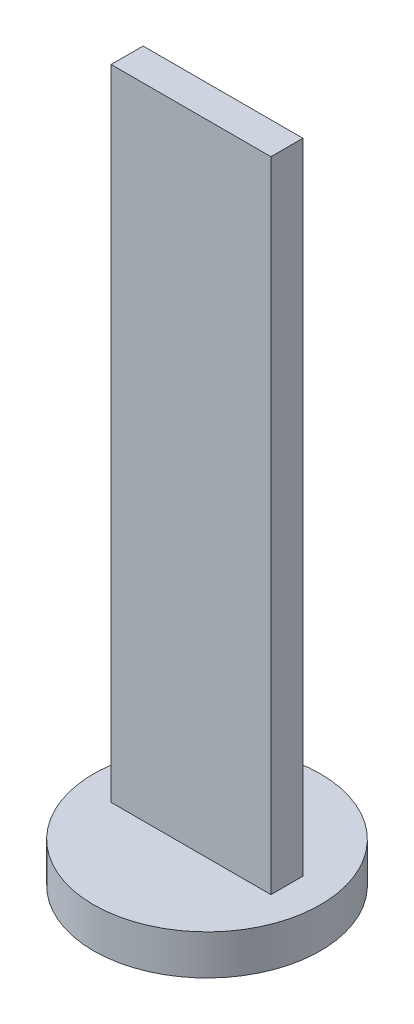
from build123d import *

# Parameters (mm, degrees)
SKETCH1_W           = 1
SKETCH1_H           = 4
BOSS_EXTRUDE1_DEPTH = 0.1
SKETCH3_R           = 0.709901951
BOSS_EXTRUDE3_DEPTH = 0.25


with BuildPart() as part:
    # Sketch1 → Boss-Extrude1 (new, symmetric)
    with BuildSketch(Plane.XY):
        Rectangle(SKETCH1_W, SKETCH1_H)
    extrude(amount=BOSS_EXTRUDE1_DEPTH, both=True)

    # Sketch3 → Boss-Extrude3 (add)
    with BuildSketch(Plane.XZ.offset(2)):
        Circle(SKETCH3_R)
    extrude(amount=BOSS_EXTRUDE3_DEPTH)


solid = part.part
